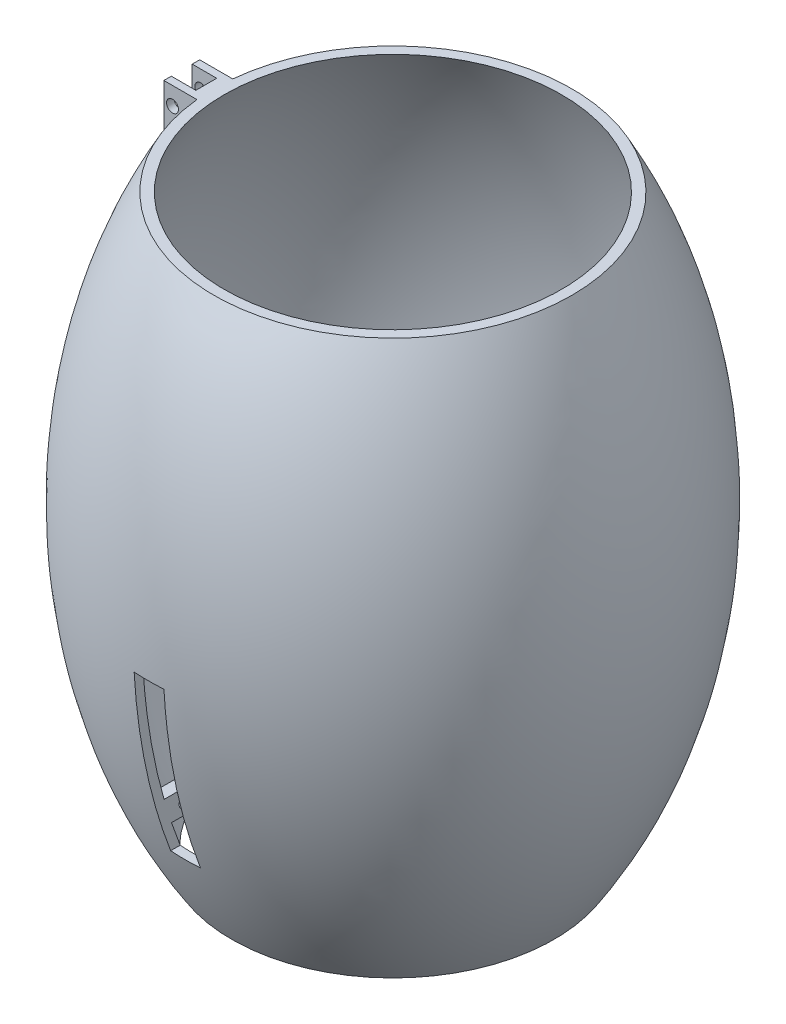
from build123d import *

# Parameters (mm, degrees)
CORTAR_EXTRUIR1_REACH             = 109.148
CROQUIS5_W                        = 60
CROQUIS5_H                        = 30
CORTAR_EXTRUIR1_DIRECTION_2_REACH = 109.148
CROQUIS6_W                        = 5
CROQUIS6_H                        = 35
CORTAR_EXTRUIR2_DEPTH             = 50
SALIENTE_EXTRUIR1_DEPTH           = 0.01
CROQUIS9_W                        = 2
CROQUIS9_H                        = 3.029502818
SALIENTE_EXTRUIR2_DEPTH           = 3
SALIENTE_EXTRUIR3_DEPTH           = 0.01
CROQUIS14_W                       = 2
CROQUIS14_H                       = 3.004168561
SALIENTE_EXTRUIR4_DEPTH           = 3
CROQUIS15_R                       = 1
CORTAR_EXTRUIR3_DEPTH             = 7
SALIENTE_EXTRUIR5_DEPTH           = 4
SALIENTE_EXTRUIR5_DEPTH_BACK      = 4
CROQUIS16_W                       = 10
CROQUIS16_H                       = 2
SALIENTE_EXTRUIR6_OUTLINE_R       = 0.959400081
SALIENTE_EXTRUIR6_DEPTH           = 35.506110237
CROQUIS19_R                       = 2
CORTAR_EXTRUIR4_DEPTH             = 2
SALIENTE_EXTRUIR7_REACH           = 135.344
CROQUIS20_W                       = 7
CROQUIS20_H                       = 6
CROQUIS26_W                       = 4.112771373
CROQUIS26_H                       = 3.5
CORTAR_EXTRUIR9_DEPTH             = 5
CROQUIS27_R                       = 1
CORTAR_EXTRUIR10_DEPTH            = 6
CORTAR_EXTRUIR11_DEPTH            = 108.148110879
CORTAR_EXTRUIR11_DEPTH_BACK       = 108.148110879
CROQUIS28_W                       = 80
CROQUIS28_H                       = 25
CORTAR_EXTRUIR12_DEPTH            = 88.210765734
CORTAR_EXTRUIR12_DEPTH_BACK       = 88.210765734
CROQUIS29_W                       = 5
CROQUIS29_H                       = 25
CROQUIS33_W                       = 2
CROQUIS33_H                       = 6
SALIENTE_EXTRUIR8_DEPTH           = 4
CROQUIS35_R                       = 1
CORTAR_EXTRUIR16_DEPTH            = 2
CROQUIS36_W                       = 2
CROQUIS36_H                       = 6
SALIENTE_EXTRUIR9_DEPTH           = 4
CROQUIS37_R                       = 1
CORTAR_EXTRUIR17_DEPTH            = 2
CROQUIS38_W                       = 2
CROQUIS38_H                       = 6
SALIENTE_EXTRUIR10_DEPTH          = 4
CROQUIS39_R                       = 1
CORTAR_EXTRUIR18_DEPTH            = 2
CROQUIS40_W                       = 2
CROQUIS40_H                       = 6
SALIENTE_EXTRUIR11_DEPTH          = 4
CORTAR_EXTRUIR19_START            = -2
CROQUIS41_R                       = 1
CORTAR_EXTRUIR19_DEPTH            = 2
SALIENTE_EXTRUIR12_START          = -10
CROQUIS42_W                       = 5
CROQUIS42_H                       = 1.405177025
SALIENTE_EXTRUIR12_DEPTH          = 10
CROQUIS44_R                       = 2
CORTAR_EXTRUIR20_DEPTH            = 2
REDONDEO1_R                       = 5
CORTAR_EXTRUIR21_START            = -36.272016138
CORTAR_EXTRUIR21_OUTLINE_W        = 5
CORTAR_EXTRUIR21_OUTLINE_H        = 4
CORTAR_EXTRUIR21_DEPTH            = 72.544032276


# Read off the part's stored shape, not the designer's step: Saliente-Extruir6, Cortar-Extruir21
with BuildPart() as part:
    # Croquis2 → Revolución1 (revolve)
    with BuildSketch(Plane.XY):
        with BuildLine():
            Line((0, -88.5), (0, -90))
            add(Edge.make_bspline(
                [(0, 60), (-23.064914086, 47.533269313), (-54.64130893, -6.917602011), (-32.096038811, -73.129329032), (0, -90)],
                knots=[0, 0, 0, 0, 0.417641514, 1, 1, 1, 1], degree=3))
            Line((0, 60), (0, 58.5))
            add(Edge.make_bspline(
                [(0, 58.5), (-22.038286696, 46.05900747), (-52.74637707, -6.955959715), (-30.993824701, -71.572302147), (0, -88.5)],
                knots=[0, 0, 0, 0, 0.415506098, 1, 1, 1, 1], degree=3))
        make_face()
    revolve(axis=Axis((0, 60, 0), (0, -1, 0)))

    # Croquis5 → Cortar-Extruir1 (cut, up to next)
    with BuildSketch(Plane(origin=(0, 0, 0), x_dir=(0, 0, -1), z_dir=(1, 0, 0)), mode=Mode.PRIVATE) as cortar_extruir1_sk1:
        with Locations((0, 45)):
            Rectangle(CROQUIS5_W, CROQUIS5_H)
    cortar_extruir1_tool1 = extrude(cortar_extruir1_sk1.sketch, amount=-CORTAR_EXTRUIR1_REACH, mode=Mode.PRIVATE) & part.part
    add(cortar_extruir1_tool1.solids().sort_by_distance((0, 45, 0))[0], mode=Mode.SUBTRACT)

    # Croquis5 → Cortar-Extruir1 direction 2 (cut, up to next)
    with BuildSketch(Plane(origin=(0, 0, 0), x_dir=(0, 0, -1), z_dir=(1, 0, 0)), mode=Mode.PRIVATE) as cortar_extruir1_direction_2_sk1:
        with Locations((0, 45)):
            Rectangle(CROQUIS5_W, CROQUIS5_H)
    cortar_extruir1_direction_2_tool1 = extrude(cortar_extruir1_direction_2_sk1.sketch, amount=CORTAR_EXTRUIR1_DIRECTION_2_REACH, mode=Mode.PRIVATE) & part.part
    add(cortar_extruir1_direction_2_tool1.solids().sort_by_distance((0, 45, 0))[0], mode=Mode.SUBTRACT)

    # Croquis6 → Cortar-Extruir2 (cut)
    with BuildSketch(Plane(origin=(0, 0, 0), x_dir=(0, 0, -1), z_dir=(1, 0, 0))):
        with Locations((0, -22.5)):
            Rectangle(CROQUIS6_W, CROQUIS6_H)
    extrude(amount=-CORTAR_EXTRUIR2_DEPTH, mode=Mode.SUBTRACT)

    # Croquis8 → Saliente-Extruir1 (add)
    with BuildSketch(Plane(origin=(0, 0, 2.5), x_dir=(-1, 0, 0), z_dir=(0, 0, -1))):
        Polygon((39.324584831, -8.150787079), (40.810913991, -8.150787079), (40.96892822, -11.176026228), (39.485256593, -11.176026228), align=None)
    extrude(amount=SALIENTE_EXTRUIR1_DEPTH)

    # Croquis9 → Saliente-Extruir2 (add)
    with BuildSketch(Plane(origin=(-38.782299065, 2.059744705, 0), x_dir=(0, 0, -1), z_dir=(0.9985926176134183, -0.05303568655142858, 0))):
        with Locations((-3.49, -11.739673569)):
            Rectangle(CROQUIS9_W, CROQUIS9_H)
    extrude(amount=SALIENTE_EXTRUIR2_DEPTH)

    # Croquis11 → Saliente-Extruir3 (add)
    with BuildSketch(Plane.XY.offset(-2.5)):
        Polygon((-40.814388341, -8.2), (-39.327869246, -8.2), (-39.486073999, -11.2), (-40.969953974, -11.2), align=None)
    extrude(amount=SALIENTE_EXTRUIR3_DEPTH)


with BuildPart() as body_2:
    # Croquis14 → Saliente-Extruir4 (new body)
    with BuildSketch(Plane(origin=(-38.787575776, 2.045459618, 0), x_dir=(0, 0, -1), z_dir=(0.9986124076966434, -0.05266174317579125, 0))):
        with Locations((3.49, -11.761780174)):
            Rectangle(CROQUIS14_W, CROQUIS14_H)
    extrude(amount=SALIENTE_EXTRUIR4_DEPTH)


with BuildPart() as cortar_extruir3_tool:
    # Croquis15 → Cortar-Extruir3 (new body)
    with BuildSketch(Plane(origin=(0, 0, -4.49), x_dir=(-1, 0, 0), z_dir=(0, 0, -1))):
        with Locations(Location((37.908943249, -9.776911226, 0), (0, 0, 90))):
            Circle(CROQUIS15_R)
    extrude(amount=-CORTAR_EXTRUIR3_DEPTH)


with BuildPart() as part_1:
    add(part.part)

    # Cortar-Extruir3: cut by cortar_extruir3_tool
    add(cortar_extruir3_tool.part, mode=Mode.SUBTRACT)



with BuildPart() as body_2_1:
    add(body_2.part)

    # Cortar-Extruir3: cut by cortar_extruir3_tool
    add(cortar_extruir3_tool.part, mode=Mode.SUBTRACT)


with BuildPart() as body_3:
    # Croquis16 → Saliente-Extruir5 (new, two sides: drawn at the far end of the back side and taken through both)
    with BuildSketch(Plane(origin=(0, 0, 0), x_dir=(0, 0, -1), z_dir=(1, 0, 0)).offset(-SALIENTE_EXTRUIR5_DEPTH_BACK)):
        with Locations((0, -20.905177025)):
            Rectangle(CROQUIS16_W, CROQUIS16_H)
    extrude(amount=SALIENTE_EXTRUIR5_DEPTH + SALIENTE_EXTRUIR5_DEPTH_BACK)


with BuildPart() as part_2:
    add(part_1.part)

    add(body_3.part)  # Saliente-Extruir6 merges body 3
    # Saliente-Extruir6 outline → Saliente-Extruir6 (add)
    with BuildSketch(Plane(origin=(4, 0, 0), x_dir=(0, 0, -1), z_dir=(1, 0, 0))):
        with Locations((0, -20.876479975)):
            Circle(SALIENTE_EXTRUIR6_OUTLINE_R)
    extrude(amount=SALIENTE_EXTRUIR6_DEPTH)

    # Croquis19 → Cortar-Extruir4 (cut)
    with BuildSketch(Plane(origin=(0, -19.905177025, 0), x_dir=(1, 0, 0), z_dir=(0, 1, 0))):
        with Locations(Location((0, 0, 0), (0, 0, 270))):
            Circle(CROQUIS19_R)
    extrude(amount=-CORTAR_EXTRUIR4_DEPTH, mode=Mode.SUBTRACT)

    # Croquis20 → Saliente-Extruir7 (add, up to next)
    with BuildSketch(Plane(origin=(0, 30, 0), x_dir=(1, 0, 0), z_dir=(0, 1, 0)), mode=Mode.PRIVATE) as saliente_extruir7_sk1:
        with Locations((-31.900454691, 0)):
            Rectangle(CROQUIS20_W, CROQUIS20_H)
    saliente_extruir7_tool1 = extrude(saliente_extruir7_sk1.sketch, amount=-SALIENTE_EXTRUIR7_REACH, mode=Mode.PRIVATE) - part_2.part
    add(saliente_extruir7_tool1.solids().sort_by_distance((-31.900455, 30, 0))[0])

    # Croquis26 → Cortar-Extruir9 (cut)
    with BuildSketch(Plane(origin=(0, 30, 0), x_dir=(1, 0, 0), z_dir=(0, 1, 0))):
        with Locations((-33.344069004, 0)):
            Rectangle(CROQUIS26_W, CROQUIS26_H)
    extrude(amount=-CORTAR_EXTRUIR9_DEPTH, mode=Mode.SUBTRACT)

    # Croquis27 → Cortar-Extruir10 (cut)
    with BuildSketch(Plane(origin=(0, 0, -3), x_dir=(-1, 0, 0), z_dir=(0, 0, -1))):
        with Locations((33.949623113, 27)):
            Circle(CROQUIS27_R)
    extrude(amount=-CORTAR_EXTRUIR10_DEPTH, mode=Mode.SUBTRACT)

    # Croquis28 → Cortar-Extruir11 (cut, two sides: drawn at the far end of the back side and taken through both)
    with BuildSketch(Plane(origin=(0, 0, 0), x_dir=(0, 0, -1), z_dir=(1, 0, 0)).offset(-CORTAR_EXTRUIR11_DEPTH_BACK)):
        with Locations((0, -77.5)):
            Rectangle(CROQUIS28_W, CROQUIS28_H)
    extrude(amount=CORTAR_EXTRUIR11_DEPTH + CORTAR_EXTRUIR11_DEPTH_BACK, mode=Mode.SUBTRACT)

    # Croquis29 → Cortar-Extruir12 (cut, two sides: drawn at the far end of the back side and taken through both)
    with BuildSketch(Plane.XY.offset(-CORTAR_EXTRUIR12_DEPTH_BACK)):
        with Locations((0, -33)):
            Rectangle(CROQUIS29_W, CROQUIS29_H)
    extrude(amount=CORTAR_EXTRUIR12_DEPTH + CORTAR_EXTRUIR12_DEPTH_BACK, mode=Mode.SUBTRACT)

    # Croquis33 → Saliente-Extruir8 (add)
    with BuildSketch(Plane(origin=(0, -45.5, 0), x_dir=(1, 0, 0), z_dir=(0, 1, 0))):
        with Locations((-3.5, -32.935759004)):
            Rectangle(CROQUIS33_W, CROQUIS33_H)
    extrude(amount=SALIENTE_EXTRUIR8_DEPTH)

    # Croquis35 → Cortar-Extruir16 (cut)
    with BuildSketch(Plane(origin=(-2.5, 0, 0), x_dir=(0, 0, -1), z_dir=(1, 0, 0))):
        with Locations(Location((-32.351213114, -43.5, 0), (0, 0, 90))):
            Circle(CROQUIS35_R)
    extrude(amount=-CORTAR_EXTRUIR16_DEPTH, mode=Mode.SUBTRACT)

    # Croquis36 → Saliente-Extruir9 (add)
    with BuildSketch(Plane(origin=(0, -45.5, 0), x_dir=(1, 0, 0), z_dir=(0, 1, 0))):
        with Locations((-3.5, 32.935759004)):
            Rectangle(CROQUIS36_W, CROQUIS36_H)
    extrude(amount=SALIENTE_EXTRUIR9_DEPTH)

    # Croquis37 → Cortar-Extruir17 (cut)
    with BuildSketch(Plane(origin=(-2.5, 0, 0), x_dir=(0, 0, -1), z_dir=(1, 0, 0))):
        with Locations(Location((32.275986409, -43.5, 0), (0, 0, 90))):
            Circle(CROQUIS37_R)
    extrude(amount=-CORTAR_EXTRUIR17_DEPTH, mode=Mode.SUBTRACT)

    # Croquis38 → Saliente-Extruir10 (add)
    with BuildSketch(Plane(origin=(0, -45.5, 0), x_dir=(1, 0, 0), z_dir=(0, 1, 0))):
        with Locations((3.5, -32.935759004)):
            Rectangle(CROQUIS38_W, CROQUIS38_H)
    extrude(amount=SALIENTE_EXTRUIR10_DEPTH)

    # Croquis39 → Cortar-Extruir18 (cut)
    with BuildSketch(Plane.ZY.offset(-2.5)):
        with Locations(Location((32.275986409, -43.5, 0), (0, 0, 270))):
            Circle(CROQUIS39_R)
    extrude(amount=-CORTAR_EXTRUIR18_DEPTH, mode=Mode.SUBTRACT)

    # Croquis40 → Saliente-Extruir11 (add)
    with BuildSketch(Plane(origin=(0, -45.5, 0), x_dir=(1, 0, 0), z_dir=(0, 1, 0))):
        with Locations((3.5, 32.935759004)):
            Rectangle(CROQUIS40_W, CROQUIS40_H)
    extrude(amount=SALIENTE_EXTRUIR11_DEPTH)

    # Croquis41 → Cortar-Extruir19 (cut)
    with BuildSketch(Plane.ZY.offset(-2.5).offset(CORTAR_EXTRUIR19_START)):
        with Locations(Location((-32.275986409, -43.5, 0), (0, 0, 90))):
            Circle(CROQUIS41_R)
    extrude(amount=CORTAR_EXTRUIR19_DEPTH, mode=Mode.SUBTRACT)

    # Croquis42 → Saliente-Extruir12 (add)
    with BuildSketch(Plane.XY.offset(5).offset(SALIENTE_EXTRUIR12_START)):
        with Locations((0, -21.202588513)):
            Rectangle(CROQUIS42_W, CROQUIS42_H)
    extrude(amount=SALIENTE_EXTRUIR12_DEPTH)

    # Croquis44 → Cortar-Extruir20 (cut)
    with BuildSketch(Plane(origin=(0, -20.5, 0), x_dir=(1, 0, 0), z_dir=(0, 1, 0))):
        with Locations(Location((0, 0, 0), (0, 0, 270))):
            Circle(CROQUIS44_R)
    extrude(amount=-CORTAR_EXTRUIR20_DEPTH, mode=Mode.SUBTRACT)

    # Redondeo1
    # the kernel refuses this fillet: 5 mm, written as the material it adds along each edge
    with BuildSketch(Plane(origin=(-31.287683318, 25, -1.75), x_dir=(-1, 0, 0), z_dir=(0, 0, 1))) as redondeo1_piece_1:
        with BuildLine():
            CenterArc((5, -4.920652941), REDONDEO1_R, 100.221015743, 79.778984257)
            Line((0, -4.920652941), (-0.1, -4.920652941))
            Line((-0.1, -4.920652941), (-0.1, 0))
            Line((-0.1, 0), (0, 0.1))
            ThreePointArc((0, 0.1), (2.056385687, 0.1), (4.095026801, 0.098413059))
            Line((4.095026801, 0.098413059), (4.112771373, 0))
        make_face()
    extrude(amount=3.5)

    # Cortar-Extruir21 outline → Cortar-Extruir21 (cut)
    with BuildSketch(Plane.XY.offset(CORTAR_EXTRUIR21_START)):
        with Locations((0, -47.5)):
            Rectangle(CORTAR_EXTRUIR21_OUTLINE_W, CORTAR_EXTRUIR21_OUTLINE_H)
    extrude(amount=CORTAR_EXTRUIR21_DEPTH, mode=Mode.SUBTRACT)


solid = Compound([body_2_1.part, part_2.part])
